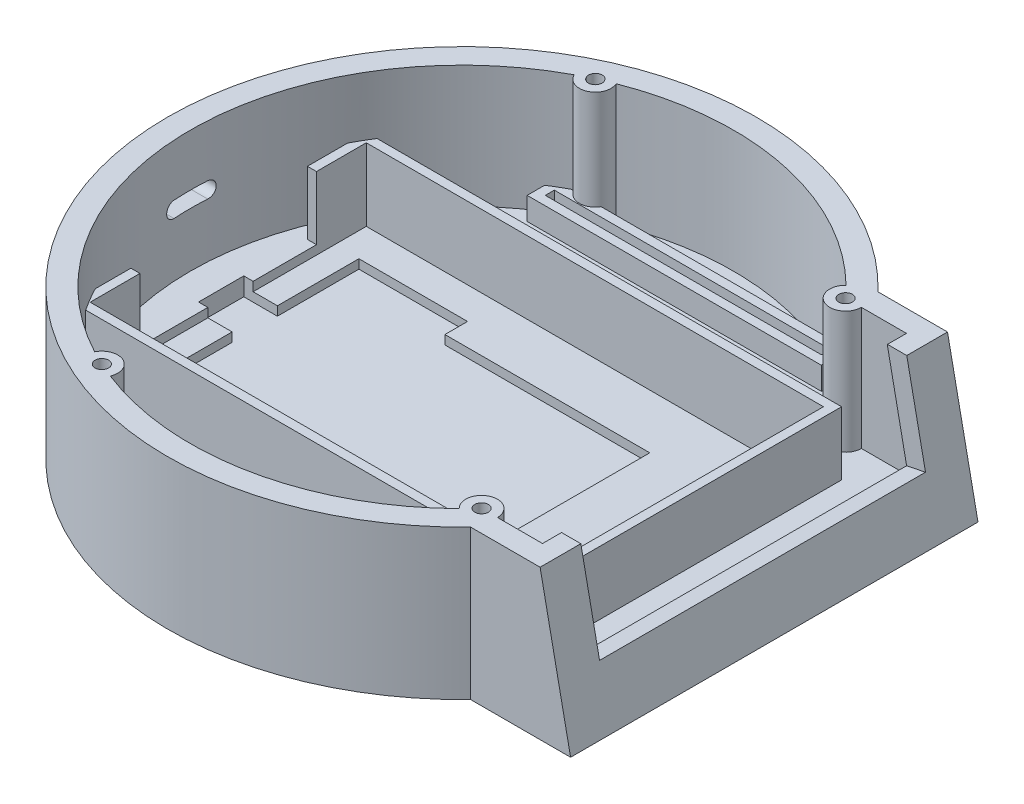
from build123d import *
from build123d.topology import SkipClean

# Parameters (mm, degrees)
SKETCH1_R                     = 65
SKETCH1_W                     = 44
SKETCH1_H                     = 90
HOUSING_DEPTH                 = 33
INTERNALCUT_DEPTH             = 27
SKETCH7_W                     = 72
SKETCH7_H                     = 25
DISPLAYCUT_DEPTH              = 27
SKETCH11_R                    = 18
WICHARGERCUT_DEPTH            = 4
SKETCH14_W                    = 6.5
SKETCH14_H                    = 6.5
BTNINTERNALCUT_DEPTH          = 3
SKETCH16_R                    = 1.95
BTNEXTERNALCUT_DEPTH          = 140.414406221
SKETCH18_R                    = 6.5
BUZZEREXTERNALCUT_DEPTH       = 4
SKETCH20_R                    = 0.35
BUZZERINTERNALCUT_DEPTH       = 134.776565507
SWITCHINTERNALCUT_OUTLINE_W   = 6.5
SWITCHINTERNALCUT_OUTLINE_H   = 20.5
SWITCHINTERNALCUT_DEPTH       = 0.01
SKETCH25_W                    = 4.1
SKETCH25_H                    = 7
SWITCHEXTERNALCUT_DEPTH       = 151.418380244
MICROUSBCUT_DEPTH             = 153.545075306
SKETCH29_R                    = 3.5
SKETCH29_R_2                  = 1.5
SCREWHOLESEXTERNAL_DEPTH      = 27
SCREWHOLESINTERNAL_DEPTH      = 99.564699657
SCREWHOLESINTERNAL_DEPTH_BACK = 99.564699657
SKETCH30_R                    = 1.5
SKETCH31_W                    = 61
SKETCH31_H                    = 2
CARDREADER_DEPTH              = 5
BATTERY_DEPTH                 = 14
SKETCH34_W                    = 68
SKETCH34_H                    = 36
WICHARGERCUT2_DEPTH           = 4
SKETCH35_W                    = 24
SKETCH35_H                    = 46
CHARGERMODULECUT_DEPTH        = 4
SKETCH36_W                    = 18.34349304
SKETCH36_H                    = 10
CHARGERCABLECUT_DEPTH         = 4
SKETCH37_R                    = 3
SKETCH37_R_2                  = 1.5
BUZZERATTACHTMENT_DEPTH       = 5
SKETCH39_W                    = 11
SKETCH39_H                    = 33
NEWEXT_DEPTH                  = 90
DIAGONALCUT_DEPTH             = 90
DISPLAYINTERNALCUT_START      = -4.8
DISPLAYINTERNALCUT_DEPTH      = 80.4
SKETCH45_W                    = 72
SKETCH45_H                    = 22
DISPLAYCUT2_DEPTH             = 5
SKETCH47_W                    = 101
SKETCH47_H                    = 61
CUT_EXTRUDE1_DEPTH            = 2
SKETCH49_R                    = 1.5
CUT_EXTRUDE2_DEPTH            = 99.561960808
CUT_EXTRUDE3_DEPTH            = 1
CUT_EXTRUDE3_DEPTH_BACK       = 4
SKETCH50_W                    = 6.5
SKETCH50_H                    = 20.5
SKETCH51_R                    = 5
BOSS_EXTRUDE1_DEPTH           = 5
FILLET1_R                     = 1
FILLET2_R                     = 1
FILLET3_R                     = 1
FILLET4_R                     = 1


# Read off the part's stored shape, not the designer's step: SwitchInternalCut
with BuildPart() as part:
    # Sketch1 → Housing (new body)
    with BuildSketch(Plane(origin=(0, 0, 0), x_dir=(1, 0, 0), z_dir=(0, 1, 0))):
        Circle(SKETCH1_R)
        with Locations((47, -0.0001724)):
            Rectangle(SKETCH1_W, SKETCH1_H)
    extrude(amount=HOUSING_DEPTH)

    # Sketch8 → InternalCut (cut)
    with BuildSketch(Plane(origin=(0, 33, 0), x_dir=(1, 0, 0), z_dir=(0, 1, 0))):
        with BuildLine():
            ThreePointArc((44.541821482, 40.1998276), (-60, 0.000232232), (44.541510291, -40.2001724))
            Line((44.541510291, -40.2001724), (19.336952431, -40.2001724))
            Line((19.336952431, -40.2001724), (19.336952431, 40.1998276))
            Line((19.336952431, 40.1998276), (44.541821482, 40.1998276))
        make_face()
        with BuildLine():
            Line((19.336952431, -40.2001724), (44.541510291, -40.2001724))
            ThreePointArc((44.541510291, -40.2001724), (56.002190214, -21.53496439), (60, 0))
            ThreePointArc((60, 0), (56.002273565, 21.534747631), (44.541821482, 40.1998276))
            Line((44.541821482, 40.1998276), (19.336952431, 40.1998276))
            Line((19.336952431, 40.1998276), (19.336952431, -40.2001724))
        make_face()
        with BuildLine():
            ThreePointArc((44.541821482, 40.1998276), (-60, 0.000232232), (44.541510291, -40.2001724))
            Line((44.541510291, -40.2001724), (19.336952431, -40.2001724))
            Line((19.336952431, -40.2001724), (19.336952431, 40.1998276))
            Line((19.336952431, 40.1998276), (44.541821482, 40.1998276))
        make_face()
        with BuildLine():
            Line((19.336952431, -40.2001724), (44.541510291, -40.2001724))
            ThreePointArc((44.541510291, -40.2001724), (56.002190214, -21.53496439), (60, 0))
            ThreePointArc((60, 0), (56.002273565, 21.534747631), (44.541821482, 40.1998276))
            Line((44.541821482, 40.1998276), (19.336952431, 40.1998276))
            Line((19.336952431, 40.1998276), (19.336952431, -40.2001724))
        make_face()
        with BuildLine():
            Line((44.541510291, -40.2001724), (64, -40.2001724))
            Line((64, -40.2001724), (64, 40.1998276))
            Line((64, 40.1998276), (44.541821482, 40.1998276))
            ThreePointArc((44.541821482, 40.1998276), (56.002273565, 21.534747631), (60, 0))
            ThreePointArc((60, 0), (56.002190214, -21.53496439), (44.541510291, -40.2001724))
        make_face()
    extrude(amount=-INTERNALCUT_DEPTH, mode=Mode.SUBTRACT)

    # Sketch7 → DisplayCut (cut)
    with BuildSketch(Plane(origin=(69, 0, 0), x_dir=(0, 0, -1), z_dir=(1, 0, 0))):
        with Locations((-0.0001724, 25.5)):
            Rectangle(SKETCH7_W, SKETCH7_H)
    extrude(amount=-DISPLAYCUT_DEPTH, mode=Mode.SUBTRACT)

    # Sketch11 → WiChargerCut (cut)
    with BuildSketch(Plane(origin=(0, 6, 0), x_dir=(1, 0, 0), z_dir=(0, 1, 0))):
        with Locations(Location((0, 0, 0), (0, 0, 270))):
            Circle(SKETCH11_R)
    extrude(amount=-WICHARGERCUT_DEPTH, mode=Mode.SUBTRACT)

    # Sketch14 → BtnInternalCut (cut)
    with BuildSketch(Plane(origin=(30.518997778, 6, -32.018027838), x_dir=(1, 0, 0), z_dir=(0, 1, 0))):
        with Locations((-1.154569722, -74.02253241)):
            Rectangle(SKETCH14_W, SKETCH14_H)
    extrude(amount=-BTNINTERNALCUT_DEPTH, mode=Mode.SUBTRACT)

    # Sketch16 → BtnExternalCut (cut, through all)
    with BuildSketch(Plane(origin=(30.518997778, 3, -32.018027838), x_dir=(1, 0, 0), z_dir=(0, 1, 0))):
        with Locations(Location((-1.154569722, -74.02253241, 0), (0, 0, 270))):
            Circle(SKETCH16_R)
    extrude(amount=-BTNEXTERNALCUT_DEPTH, mode=Mode.SUBTRACT)

    # Sketch18 → BuzzerExternalCut (cut)
    with BuildSketch(Plane(origin=(7.487765852, 6, 43.077256075), x_dir=(1, 0, 0), z_dir=(0, 1, 0))):
        with Locations(Location((-25.006618322, 0, 0), (0, 0, 270))):
            Circle(SKETCH18_R)
    extrude(amount=-BUZZEREXTERNALCUT_DEPTH, mode=Mode.SUBTRACT)

    # Sketch20 → BuzzerInternalCut (cut, through all)
    with BuildSketch(Plane(origin=(7.487765852, 2, 43.077256075), x_dir=(1, 0, 0), z_dir=(0, 1, 0))):
        with Locations(Location((-24.042348329, 4.522315504, 0), (0, 0, 270))):
            Circle(SKETCH20_R)
        with Locations(Location((-26.042348329, 3.020429056, 0), (0, 0, 270))):
            Circle(SKETCH20_R)
        with Locations(Location((-28.042348329, 3.020429056, 0), (0, 0, 270))):
            Circle(SKETCH20_R)
        with Locations(Location((-30.042348329, 1.518542609, 0), (0, 0, 270))):
            Circle(SKETCH20_R)
        with Locations(Location((-30.042348329, 0.016656161, 0), (0, 0, 270))):
            Circle(SKETCH20_R)
        with Locations(Location((-30.042348329, -1.485230286, 0), (0, 0, 270))):
            Circle(SKETCH20_R)
        with Locations(Location((-28.042348329, 0.016656161, 0), (0, 0, 270))):
            Circle(SKETCH20_R)
        with Locations(Location((-28.042348329, 1.518542609, 0), (0, 0, 270))):
            Circle(SKETCH20_R)
        with Locations(Location((-28.042348329, -1.485230286, 0), (0, 0, 270))):
            Circle(SKETCH20_R)
        with Locations(Location((-28.042348329, -2.987116733, 0), (0, 0, 270))):
            Circle(SKETCH20_R)
        with Locations(Location((-26.042348329, 0.016656161, 0), (0, 0, 270))):
            Circle(SKETCH20_R)
        with Locations(Location((-26.042348329, 1.518542609, 0), (0, 0, 270))):
            Circle(SKETCH20_R)
        with Locations(Location((-26.042348329, -1.485230286, 0), (0, 0, 270))):
            Circle(SKETCH20_R)
        with Locations(Location((-26.042348329, -2.987116733, 0), (0, 0, 270))):
            Circle(SKETCH20_R)
        with Locations(Location((-26.042348329, -4.489003181, 0), (0, 0, 270))):
            Circle(SKETCH20_R)
        with Locations(Location((-24.042348329, -4.489003181, 0), (0, 0, 270))):
            Circle(SKETCH20_R)
        with Locations(Location((-24.042348329, -2.987116733, 0), (0, 0, 270))):
            Circle(SKETCH20_R)
        with Locations(Location((-24.042348329, -1.485230286, 0), (0, 0, 270))):
            Circle(SKETCH20_R)
        with Locations(Location((-24.042348329, 0.016656161, 0), (0, 0, 270))):
            Circle(SKETCH20_R)
        with Locations(Location((-24.042348329, 1.518542609, 0), (0, 0, 270))):
            Circle(SKETCH20_R)
        with Locations(Location((-24.042348329, 3.020429056, 0), (0, 0, 270))):
            Circle(SKETCH20_R)
        with Locations(Location((-22.042348329, 3.020429056, 0), (0, 0, 270))):
            Circle(SKETCH20_R)
        with Locations(Location((-22.042348329, 1.518542609, 0), (0, 0, 270))):
            Circle(SKETCH20_R)
        with Locations(Location((-22.042348329, 0.016656161, 0), (0, 0, 270))):
            Circle(SKETCH20_R)
        with Locations(Location((-22.042348329, -1.485230286, 0), (0, 0, 270))):
            Circle(SKETCH20_R)
        with Locations(Location((-22.042348329, -2.987116733, 0), (0, 0, 270))):
            Circle(SKETCH20_R)
        with Locations(Location((-20.042348329, -1.485230286, 0), (0, 0, 270))):
            Circle(SKETCH20_R)
        with Locations(Location((-20.042348329, 0.016656161, 0), (0, 0, 270))):
            Circle(SKETCH20_R)
        with Locations(Location((-20.042348329, 1.518542609, 0), (0, 0, 270))):
            Circle(SKETCH20_R)
        with Locations(Location((-26.042348329, 4.522315504, 0), (0, 0, 270))):
            Circle(SKETCH20_R)
    extrude(amount=-BUZZERINTERNALCUT_DEPTH, mode=Mode.SUBTRACT)

    # SwitchInternalCut outline → SwitchInternalCut (add)
    with BuildSketch(Plane(origin=(-4.277787828, 6, 63.55969363), x_dir=(1, 0, 0), z_dir=(0, 1, 0))):
        with Locations((24.809044431, 19.599064282)):
            Rectangle(SWITCHINTERNALCUT_OUTLINE_W, SWITCHINTERNALCUT_OUTLINE_H)
    extrude(amount=SWITCHINTERNALCUT_DEPTH)

    # Sketch25 → SwitchExternalCut (cut, through all)
    with BuildSketch(Plane(origin=(-4.277787828, 6.01, 63.55969363), x_dir=(1, 0, 0), z_dir=(0, 1, 0))):
        with Locations((24.709044431, 19.499064282)):
            Rectangle(SKETCH25_W, SKETCH25_H)
    extrude(amount=-SWITCHEXTERNALCUT_DEPTH, mode=Mode.SUBTRACT)

    # Sketch28 → MicroUSBCut (cut, through all)
    with BuildSketch(Plane(origin=(69, 0, 0), x_dir=(0, 0, -1), z_dir=(1, 0, 0))):
        with BuildLine():
            Line((-3.7251724, 21.5), (3.7248276, 21.5))
            ThreePointArc((3.7248276, 21.5), (5.4748276, 19.75), (3.7248276, 18))
            Line((3.7248276, 18), (-3.7251724, 18))
            ThreePointArc((-3.7251724, 18), (-5.4751724, 19.75), (-3.7251724, 21.5))
        make_face()
    extrude(amount=-MICROUSBCUT_DEPTH, mode=Mode.SUBTRACT)

    # Sketch29 → ScrewHolesExternal (add)
    # profile 1 of 4: a face of its own
    with BuildSketch(Plane(origin=(0, 6, 0), x_dir=(1, 0, 0), z_dir=(0, 1, 0))):
        with Locations((-25, 54.445965177)):
            Circle(SKETCH29_R)
        with Locations((-25, 54.445965177)):
            Circle(SKETCH29_R_2, mode=Mode.SUBTRACT)
    # profile 2 of 4: a face of its own
    with BuildSketch(Plane(origin=(0, 6, 0), x_dir=(1, 0, 0), z_dir=(0, 1, 0))):
        with Locations((-25, -54.543560573)):
            Circle(SKETCH29_R)
        with Locations((-25, -54.543560573)):
            Circle(SKETCH29_R_2, mode=Mode.SUBTRACT)
    # profile 3 of 4: a face of its own
    with BuildSketch(Plane(origin=(0, 6, 0), x_dir=(1, 0, 0), z_dir=(0, 1, 0))):
        with Locations((44.541821482, 40.1998276)):
            Circle(SKETCH29_R)
        with Locations((44.541821482, 40.1998276)):
            Circle(SKETCH29_R_2, mode=Mode.SUBTRACT)
    # profile 4 of 4: a face of its own
    with BuildSketch(Plane(origin=(0, 6, 0), x_dir=(1, 0, 0), z_dir=(0, 1, 0))):
        with Locations((44.541510291, -40.2001724)):
            Circle(SKETCH29_R)
        with Locations((44.541510291, -40.2001724)):
            Circle(SKETCH29_R_2, mode=Mode.SUBTRACT)
    extrude(amount=SCREWHOLESEXTERNAL_DEPTH)

    # Sketch30 → ScrewHolesInternal (cut, two sides: drawn at the far end of the back side and taken through both)
    with SkipClean():  # the faces are left unmerged after this step: merging them gives an invalid solid
        with BuildSketch(Plane(origin=(0, 6, 0), x_dir=(1, 0, 0), z_dir=(0, 1, 0)).offset(-SCREWHOLESINTERNAL_DEPTH_BACK)):
            with Locations(Location((44.541821482, 40.1998276, 0), (0, 0, 270))):
                Circle(SKETCH30_R)
            with Locations(Location((-25, -54.543560573, 0), (0, 0, 270))):
                Circle(SKETCH30_R)
            with Locations(Location((44.541510291, -40.2001724, 0), (0, 0, 270))):
                Circle(SKETCH30_R)
            with Locations(Location((-25.037015645, 54.526579277, 0), (0, 0, 270))):
                Circle(SKETCH30_R)
        extrude(amount=SCREWHOLESINTERNAL_DEPTH + SCREWHOLESINTERNAL_DEPTH_BACK, mode=Mode.SUBTRACT)

    # Sketch31 → CardReader (add)
    with SkipClean():  # the faces are left unmerged after this step: merging them gives an invalid solid
        with BuildSketch(Plane(origin=(-1.88245846, 6, -2.088376012), x_dir=(1, 0, 0), z_dir=(0, 1, 0))):
            Polygon((30.831609754, 50.620558061), (-30.418390246, 50.620558061), (-30.418390246, 44.620558061), (34.581609754, 44.620558061), (34.581609754, 47.725008054), align=None)
            with Locations((2.081609754, 47.620558061)):
                Rectangle(SKETCH31_W, SKETCH31_H, mode=Mode.SUBTRACT)
        extrude(amount=CARDREADER_DEPTH)

    # Sketch32 → Battery (add)
    with SkipClean():  # the faces are left unmerged after this step: merging them gives an invalid solid
        with BuildSketch(Plane(origin=(0, 6, 0), x_dir=(1, 0, 0), z_dir=(0, 1, 0))):
            Polygon((-53.132079202, -20), (-51.132079202, -20), (-51.132079202, -31), (49.867920798, -31), (49.867920798, 30), (-51.132079202, 30), (-51.132079202, 19), (-53.132079202, 19), (-53.132079202, 32), (51.867920798, 32), (51.867920798, -33), (-53.132079202, -33), align=None)
        extrude(amount=BATTERY_DEPTH)

    # Sketch34 → WiChargerCut2 (cut)
    with SkipClean():  # the faces are left unmerged after this step: merging them gives an invalid solid
        with BuildSketch(Plane(origin=(0, 6, 0), x_dir=(1, 0, 0), z_dir=(0, 1, 0))):
            with Locations((-10.5, 0)):
                Rectangle(SKETCH34_W, SKETCH34_H)
        extrude(amount=-WICHARGERCUT2_DEPTH, mode=Mode.SUBTRACT)

    # Sketch35 → ChargerModuleCut (cut)
    with SkipClean():  # the faces are left unmerged after this step: merging them gives an invalid solid
        with BuildSketch(Plane(origin=(0, 6, 0), x_dir=(1, 0, 0), z_dir=(0, 1, 0))):
            with Locations((-33.763525433, 0)):
                Rectangle(SKETCH35_W, SKETCH35_H)
        extrude(amount=-CHARGERMODULECUT_DEPTH, mode=Mode.SUBTRACT)

    # Sketch36 → ChargerCableCut (cut)
    with SkipClean():  # the faces are left unmerged after this step: merging them gives an invalid solid
        with BuildSketch(Plane(origin=(0, 6, 0), x_dir=(1, 0, 0), z_dir=(0, 1, 0))):
            with Locations((-44.020906375, 0)):
                Rectangle(SKETCH36_W, SKETCH36_H)
        extrude(amount=-CHARGERCABLECUT_DEPTH, mode=Mode.SUBTRACT)

    # Sketch37 → BuzzerAttachtment (add)
    with SkipClean():  # the faces are left unmerged after this step: merging them gives an invalid solid
        with BuildSketch(Plane(origin=(0, 6, 0), x_dir=(1, 0, 0), z_dir=(0, 1, 0))):
            with Locations(Location((-6.51885247, -43.683031415, 0), (0, 0, 270))):
                Circle(SKETCH37_R)
            with Locations(Location((-6.51885247, -43.683031415, 0), (0, 0, 270))):
                Circle(SKETCH37_R_2, mode=Mode.SUBTRACT)
        extrude(amount=BUZZERATTACHTMENT_DEPTH)

    # Sketch39 → NewExt (add)
    with SkipClean():  # the faces are left unmerged after this step: merging them gives an invalid solid
        with BuildSketch(Plane.XY.offset(45.0001724)):
            with Locations((63.5, 16.5)):
                Rectangle(SKETCH39_W, SKETCH39_H)
        extrude(amount=-NEWEXT_DEPTH)

    # Sketch38 → DiagonalCut (cut)
    with SkipClean():  # the faces are left unmerged after this step: merging them gives an invalid solid
        with BuildSketch(Plane(origin=(0, 0, -44.9998276), x_dir=(-1, 0, 0), z_dir=(0, 0, -1))):
            Polygon((-59, 49), (-69, 0), (-69, 49), align=None)
        extrude(amount=-DIAGONALCUT_DEPTH, mode=Mode.SUBTRACT)

    # Sketch43 → DisplayInternalCut (cut)
    with SkipClean():  # the faces are left unmerged after this step: merging them gives an invalid solid
        with BuildSketch(Plane.XY.offset(45.0001724).offset(DISPLAYINTERNALCUT_START)):
            Polygon((63.830449902, 4), (57.951996098, 33), (57.951996098, 6), (61.425039295, 6), (61.830449902, 4), align=None)
        extrude(amount=-DISPLAYINTERNALCUT_DEPTH, mode=Mode.SUBTRACT)

    # Sketch45 → DisplayCut2 (cut)
    with SkipClean():  # the faces are left unmerged after this step: merging them gives an invalid solid
        with BuildSketch(Plane(origin=(66.241103559, 13.518592563, 0), x_dir=(0, 0, -1), z_dir=(0.979804058780407, 0.1999600119960014, 0))):
            with Locations((-0.0001724, 10.202759172)):
                Rectangle(SKETCH45_W, SKETCH45_H)
        extrude(amount=-DISPLAYCUT2_DEPTH, mode=Mode.SUBTRACT)

    # Sketch47 → Cut-Extrude1 (cut)
    with SkipClean():  # the faces are left unmerged after this step: merging them gives an invalid solid
        with BuildSketch(Plane(origin=(0, 6, 0), x_dir=(1, 0, 0), z_dir=(0, 1, 0))):
            with Locations((-0.632079202, -0.5)):
                Rectangle(SKETCH47_W, SKETCH47_H)
        extrude(amount=-CUT_EXTRUDE1_DEPTH, mode=Mode.SUBTRACT)

    # Sketch49 → Cut-Extrude2 (cut, through all)
    with SkipClean():  # the faces are left unmerged after this step: merging them gives an invalid solid
        with BuildSketch(Plane(origin=(0, 6.01, 0), x_dir=(1, 0, 0), z_dir=(0, 1, 0))):
            with Locations(Location((20.631256603, -51.210629348, 0), (0, 0, 270))):
                Circle(SKETCH49_R)
            with Locations(Location((20.631256603, -36.710629348, 0), (0, 0, 270))):
                Circle(SKETCH49_R)
        extrude(amount=-CUT_EXTRUDE2_DEPTH, mode=Mode.SUBTRACT)

    # Sketch50 → Cut-Extrude3 (cut, two sides: drawn at the far end of the back side and taken through both)
    with SkipClean():  # the faces are left unmerged after this step: merging them gives an invalid solid
        with BuildSketch(Plane(origin=(0, 6, 0), x_dir=(1, 0, 0), z_dir=(0, 1, 0)).offset(-CUT_EXTRUDE3_DEPTH_BACK)):
            with Locations((20.531256603, -43.960629348)):
                Rectangle(SKETCH50_W, SKETCH50_H)
        extrude(amount=CUT_EXTRUDE3_DEPTH + CUT_EXTRUDE3_DEPTH_BACK, mode=Mode.SUBTRACT)

    # Sketch51 → Boss-Extrude1 (add)
    with SkipClean():  # the faces are left unmerged after this step: merging them gives an invalid solid
        with BuildSketch(Plane.XZ):
            with Locations(Location((57, 33.0001724, 0), (0, 0, 90))):
                Circle(SKETCH51_R)
            with Locations(Location((57, -32.9998276, 0), (0, 0, 90))):
                Circle(SKETCH51_R)
            with Locations(Location((-36, 34.698703146, 0), (0, 0, 90))):
                Circle(SKETCH51_R)
            with Locations(Location((-36, -34.698703146, 0), (0, 0, 90))):
                Circle(SKETCH51_R)
        extrude(amount=BOSS_EXTRUDE1_DEPTH)

    # Fillet1
    fillet1_edges = [part.edges().sort_by_distance(p)[0] for p in [
        (57, -5, 28.0001724),
    ]]
    fillet(fillet1_edges, radius=FILLET1_R)

    # Fillet2
    fillet2_edges = [part.edges().sort_by_distance(p)[0] for p in [
        (-36, -5, 29.698703146),
    ]]
    fillet(fillet2_edges, radius=FILLET2_R)

    # Fillet3
    fillet3_edges = [part.edges().sort_by_distance(p)[0] for p in [
        (57, -5, -37.9998276),
    ]]
    fillet(fillet3_edges, radius=FILLET3_R)

    # Fillet4
    fillet4_edges = [part.edges().sort_by_distance(p)[0] for p in [
        (-36, -5, -39.698703146),
    ]]
    fillet(fillet4_edges, radius=FILLET4_R)


solid = part.part
